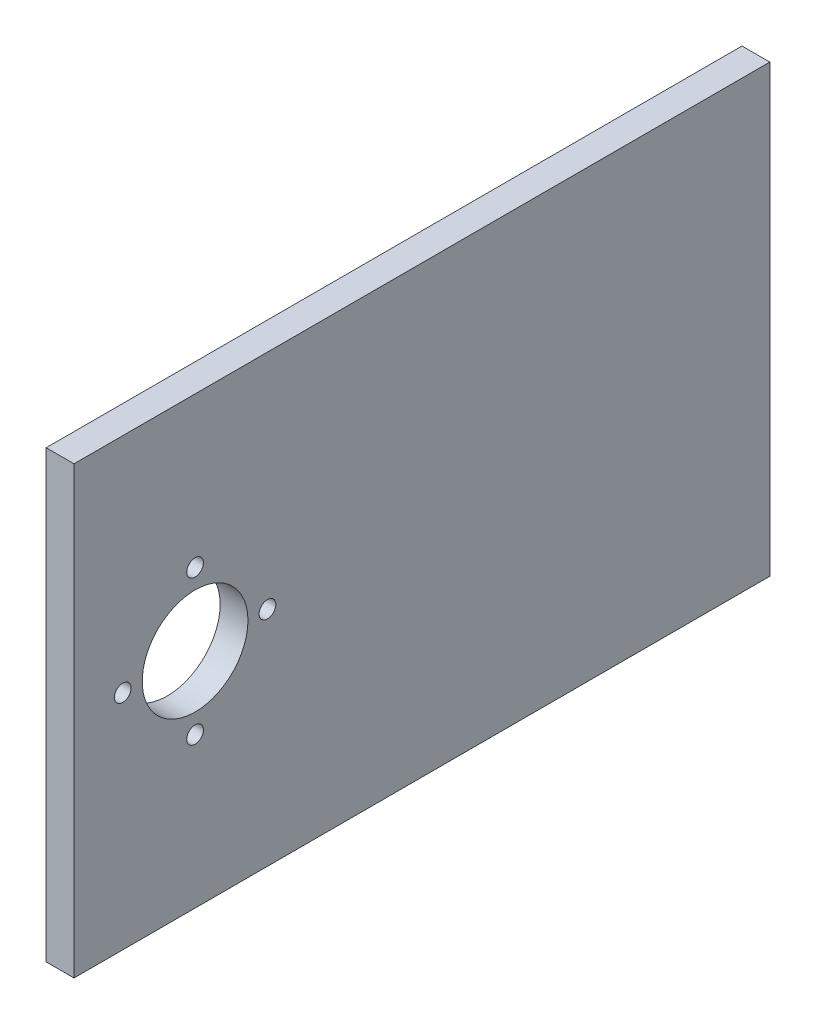
from build123d import *

# Parameters (mm, degrees)
SKETCH1_W           = 80
SKETCH1_H           = 125
SKETCH1_R           = 1.5
SKETCH1_R_2         = 9.5
BOSS_EXTRUDE1_DEPTH = 5


with BuildPart() as part:
    # Sketch1 → Boss-Extrude1 (new body)
    with BuildSketch(Plane.YZ):
        Rectangle(SKETCH1_W, SKETCH1_H)
        with Locations((0, 53.75)):
            Circle(SKETCH1_R, mode=Mode.SUBTRACT)
        with Locations((0, 27.75)):
            Circle(SKETCH1_R, mode=Mode.SUBTRACT)
        with Locations((-13, 40.75)):
            Circle(SKETCH1_R, mode=Mode.SUBTRACT)
        with Locations((13, 40.75)):
            Circle(SKETCH1_R, mode=Mode.SUBTRACT)
        with Locations((0, 40.75)):
            Circle(SKETCH1_R_2, mode=Mode.SUBTRACT)
    extrude(amount=BOSS_EXTRUDE1_DEPTH)


solid = part.part
